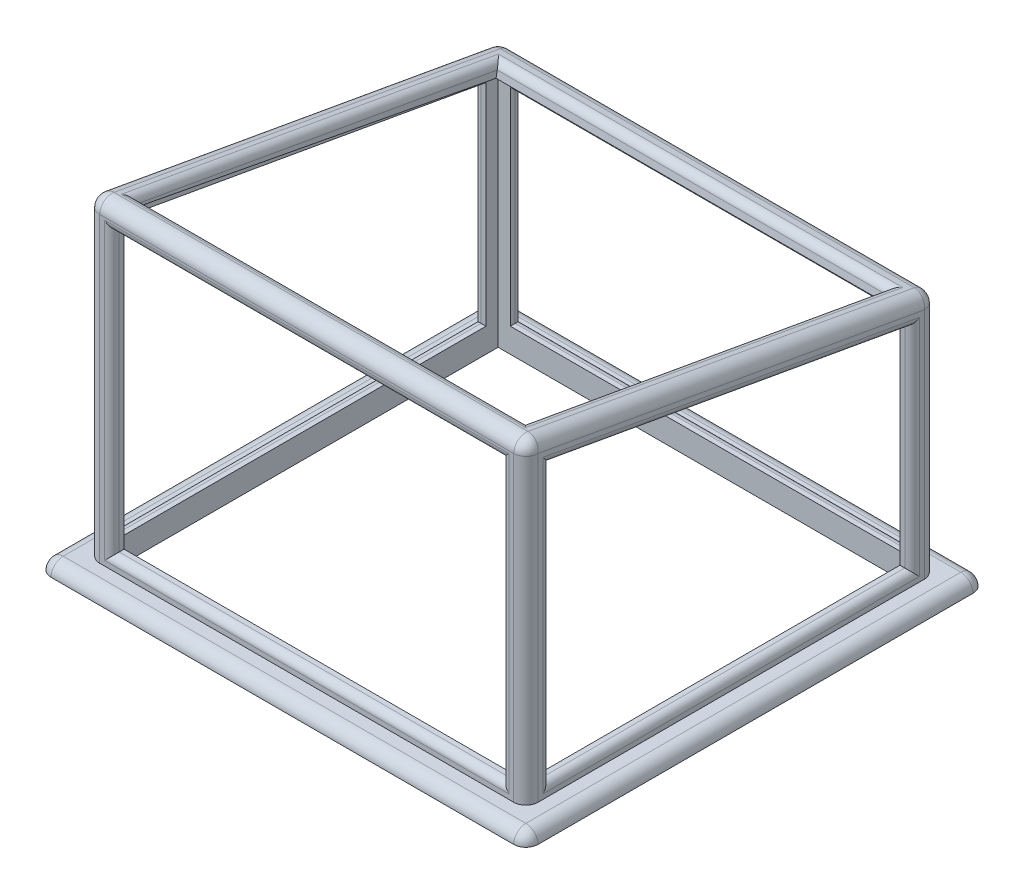
from build123d import *

# Parameters (mm, degrees)
SKETCH1_W           = 180
SKETCH1_H           = 168.6
SKETCH1_W_2         = 170
SKETCH1_H_2         = 158.6
BOSS_EXTRUDE1_DEPTH = 135
SKETCH1_3_W         = 170
SKETCH1_3_H         = 158.6
SKETCH1_3_W_2       = 160
SKETCH1_3_H_2       = 148.6
BOSS_EXTRUDE2_DEPTH = 135
CUT_EXTRUDE1_DEPTH  = 180
SKETCH3_W           = 160
SKETCH3_H           = 151.248240867
CUT_EXTRUDE2_DEPTH  = 10
SKETCH4_W           = 170
SKETCH4_H           = 158.6
CUT_EXTRUDE3_DEPTH  = 100
CUT_EXTRUDE5_DEPTH  = 170
CUT_EXTRUDE6_DEPTH  = 180
SKETCH7_W           = 160
SKETCH7_H           = 115
CUT_EXTRUDE7_DEPTH  = 10
SKETCH8_W           = 160
SKETCH8_H           = 85
CUT_EXTRUDE8_DEPTH  = 10
FILLET2_R           = 3
FILLET3_R           = 3
SKETCH9_W           = 180
SKETCH9_H           = 5
BOSS_EXTRUDE3_DEPTH = 10
SKETCH10_W          = 180
SKETCH10_H          = 5
BOSS_EXTRUDE4_DEPTH = 10
SKETCH11_W          = 188.6
SKETCH11_H          = 5
BOSS_EXTRUDE5_DEPTH = 10
SKETCH12_W          = 188.6
SKETCH12_H          = 5
BOSS_EXTRUDE6_DEPTH = 10
FILLET4_R           = 5
FILLET5_R           = 5


with BuildPart() as part:
    # Sketch1 → Boss-Extrude1 (new body)
    with BuildSketch(Plane(origin=(0, 0, 0), x_dir=(1, 0, 0), z_dir=(0, 1, 0))):
        with Locations((85, 79.3)):
            Rectangle(SKETCH1_W, SKETCH1_H)
        with Locations((85, 79.3)):
            Rectangle(SKETCH1_W_2, SKETCH1_H_2, mode=Mode.SUBTRACT)
    extrude(amount=BOSS_EXTRUDE1_DEPTH)

    # Sketch1<3> → Boss-Extrude2 (add)
    # profile 1 of 2: a face of its own
    with BuildSketch(Plane(origin=(0, 0, 0), x_dir=(1, 0, 0), z_dir=(0, 1, 0))):
        with Locations((85, 79.3)):
            Rectangle(SKETCH1_3_W, SKETCH1_3_H)
        with Locations((85, 79.3)):
            Rectangle(SKETCH1_3_W_2, SKETCH1_3_H_2, mode=Mode.SUBTRACT)
    # profile 2 of 2: a face of its own
    with BuildSketch(Plane(origin=(0, 0, 0), x_dir=(1, 0, 0), z_dir=(0, 1, 0))):
        with Locations((85, 79.3)):
            Rectangle(SKETCH1_3_W_2, SKETCH1_3_H_2)
    extrude(amount=BOSS_EXTRUDE2_DEPTH)

    # Sketch2 → Cut-Extrude1 (cut)
    with BuildSketch(Plane(origin=(175, 0, 0), x_dir=(0, 0, -1), z_dir=(1, 0, 0))):
        Polygon((-5, 135), (163.6, 135), (163.6, 105), align=None)
    extrude(amount=-CUT_EXTRUDE1_DEPTH, mode=Mode.SUBTRACT)

    # Sketch3 → Cut-Extrude2 (cut)
    with BuildSketch(Plane(origin=(0, 129.994537263, -23.130700581), x_dir=(1, 0, 0), z_dir=(0, 0.9845356609009732, -0.17518428129910554))):
        with Locations((85, 57.051564154)):
            Rectangle(SKETCH3_W, SKETCH3_H)
    extrude(amount=-CUT_EXTRUDE2_DEPTH, mode=Mode.SUBTRACT)

    # Sketch4 → Cut-Extrude3 (cut)
    with BuildSketch(Plane.XZ):
        with Locations((85, -79.3)):
            Rectangle(SKETCH4_W, SKETCH4_H)
    extrude(amount=-CUT_EXTRUDE3_DEPTH, mode=Mode.SUBTRACT)

    # Sketch5 → Cut-Extrude5 (cut)
    with BuildSketch(Plane(origin=(0, 0, 0), x_dir=(0, 0, -1), z_dir=(1, 0, 0))):
        Polygon((0, 130), (158.6, 100), (0, 100), align=None)
    extrude(amount=CUT_EXTRUDE5_DEPTH, mode=Mode.SUBTRACT)

    # Sketch6 → Cut-Extrude6 (cut)
    with BuildSketch(Plane(origin=(175, 0, 0), x_dir=(0, 0, -1), z_dir=(1, 0, 0))):
        Polygon((5, 10), (153.6, 10), (153.6, 96.622287019), (5, 123.063568157), align=None)
    extrude(amount=-CUT_EXTRUDE6_DEPTH, mode=Mode.SUBTRACT)

    # Sketch7 → Cut-Extrude7 (cut)
    with BuildSketch(Plane.XY.offset(5)):
        with Locations((85, 67.5)):
            Rectangle(SKETCH7_W, SKETCH7_H)
    extrude(amount=-CUT_EXTRUDE7_DEPTH, mode=Mode.SUBTRACT)

    # Sketch8 → Cut-Extrude8 (cut)
    with BuildSketch(Plane(origin=(0, 0, -163.6), x_dir=(-1, 0, 0), z_dir=(0, 0, -1))):
        with Locations((-85, 52.5)):
            Rectangle(SKETCH8_W, SKETCH8_H)
    extrude(amount=-CUT_EXTRUDE8_DEPTH, mode=Mode.SUBTRACT)

    # Fillet2
    fillet2_edges = [part.edges().sort_by_distance(p)[0] for p in [
        (85, 106.751842813, -153.754643391),
        (165, 120, -79.3),
        (5, 120, -79.3),
        (85, 133.248157187, -4.845356609),
    ]]
    fillet(fillet2_edges, radius=FILLET2_R)

    # Fillet3
    fillet3_edges = [part.edges().sort_by_distance(p)[0] for p in [
        (-5, 10, -79.3),
        (-5, 66.531784079, -5),
        (-5, 109.842927588, -79.3),
        (-5, 53.311143509, -153.6),
        (175, 10, -79.3),
        (175, 53.311143509, -153.6),
        (175, 109.842927588, -79.3),
        (175, 66.531784079, -5),
        (165, 67.5, 5),
        (85, 10, 5),
        (85, 125, 5),
        (5, 67.5, 5),
        (85, 95, -163.6),
        (5, 52.5, -163.6),
        (165, 52.5, -163.6),
        (85, 10, -163.6),
    ]]
    fillet(fillet3_edges, radius=FILLET3_R)

    # Sketch9 → Boss-Extrude3 (add)
    with BuildSketch(Plane(origin=(0, 0, -163.6), x_dir=(-1, 0, 0), z_dir=(0, 0, -1))):
        with Locations((-85, 2.5)):
            Rectangle(SKETCH9_W, SKETCH9_H)
    extrude(amount=BOSS_EXTRUDE3_DEPTH)

    # Sketch10 → Boss-Extrude4 (add)
    with BuildSketch(Plane.XY.offset(5)):
        with Locations((85, 2.5)):
            Rectangle(SKETCH10_W, SKETCH10_H)
    extrude(amount=BOSS_EXTRUDE4_DEPTH)

    # Sketch11 → Boss-Extrude5 (add)
    with BuildSketch(Plane.ZY.offset(5)):
        with Locations((-79.3, 2.5)):
            Rectangle(SKETCH11_W, SKETCH11_H)
    extrude(amount=BOSS_EXTRUDE5_DEPTH)

    # Sketch12 → Boss-Extrude6 (add)
    with BuildSketch(Plane(origin=(175, 0, 0), x_dir=(0, 0, -1), z_dir=(1, 0, 0))):
        with Locations((79.3, 2.5)):
            Rectangle(SKETCH12_W, SKETCH12_H)
    extrude(amount=BOSS_EXTRUDE6_DEPTH)

    # Fillet4
    fillet4_edges = [part.edges().sort_by_distance(p)[0] for p in [
        (85, 135, 5),
        (175, 70, 5),
        (-5, 70, 5),
        (-5, 55, -163.6),
        (175, 55, -163.6),
        (-5, 120, -79.3),
        (85, 105, -163.6),
        (175, 120, -79.3),
    ]]
    fillet(fillet4_edges, radius=FILLET4_R)

    # Fillet5
    fillet5_edges = [part.edges().sort_by_distance(p)[0] for p in [
        (85, 5, -173.6),
        (85, 5, 15),
        (-15, 2.5, -173.6),
        (-15, 2.5, 15),
        (-15, 5, -79.3),
        (185, 2.5, 15),
        (185, 2.5, -173.6),
        (185, 5, -79.3),
    ]]
    fillet(fillet5_edges, radius=FILLET5_R - 0.0001)  # a hair under: the kernel refuses the full size


solid = part.part
